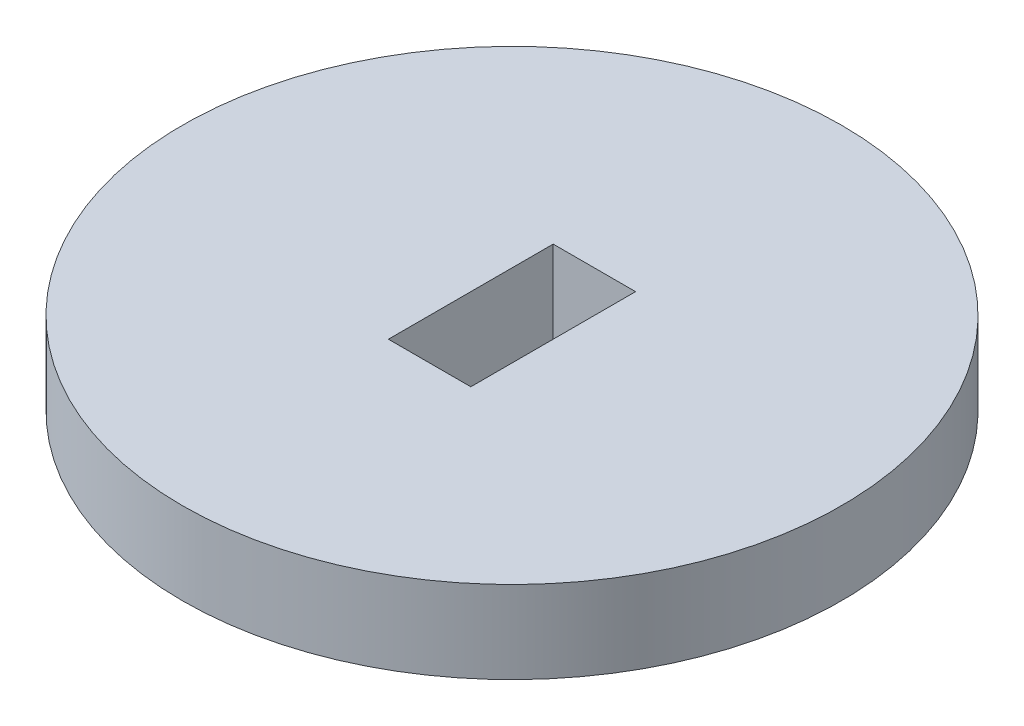
from build123d import *

# Parameters (mm, degrees)
SKETCH1_R           = 12.7
SKETCH1_W           = 3.175
SKETCH1_H           = 6.35
BOSS_EXTRUDE1_DEPTH = 3.175


with BuildPart() as part:
    # Sketch1 → Boss-Extrude1 (new body)
    with BuildSketch(Plane(origin=(0, 0, 0), x_dir=(1, 0, 0), z_dir=(0, 1, 0))):
        Circle(SKETCH1_R)
        Rectangle(SKETCH1_W, SKETCH1_H, mode=Mode.SUBTRACT)
    extrude(amount=BOSS_EXTRUDE1_DEPTH)


solid = part.part
